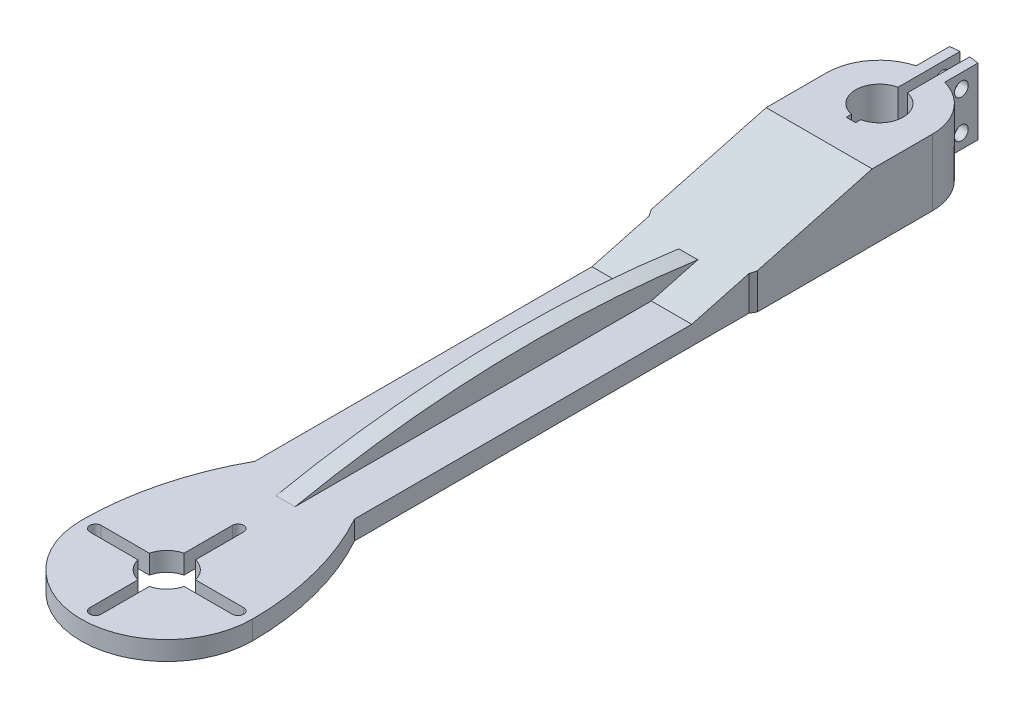
from build123d import *

# Parameters (mm, degrees)
SKETCH_1_R          = 5
EXTRUDE_1_DEPTH     = 4
SKETCH_2_R          = 5
EXTRUDE_2_DEPTH     = 10
CUT_EXTRUDE_2_DEPTH = 170.257200733
CHAMFER_1_SIZE      = 37.320508076
CHAMFER_1_SIZE_2    = 10
EXTRUDE_3_DEPTH     = 2
SKETCH_6_W          = 2
SKETCH_6_H          = 48
CUT_EXTRUDE_4_DEPTH = 170.54055562
SKETCH_7_R          = 1.45
CUT_EXTRUDE_5_DEPTH = 170.857764694


with BuildPart() as part:
    # 스케치1 → 보스-돌출1 (new body)
    with BuildSketch(Plane(origin=(0, 0, 0), x_dir=(1, 0, 0), z_dir=(0, 1, 0))):
        with BuildLine():
            ThreePointArc((18, 150), (0, 168), (-18, 150))
            Line((-18, 150), (-18, 0))
            ThreePointArc((-18, 0), (0, -18), (18, 0))
            Line((18, 0), (18, 150))
        make_face()
        with BuildLine():
            ThreePointArc((-15, -1.2), (-16.2, 0), (-15, 1.2))
            Line((-15, 1.2), (-4.85386444, 1.2))
            ThreePointArc((-4.85386444, 1.2), (-3.535533906, 3.535533906), (-1.2, 4.85386444))
            Line((-1.2, 4.85386444), (-1.2, 15))
            ThreePointArc((-1.2, 15), (0, 16.2), (1.2, 15))
            Line((1.2, 15), (1.2, 4.85386444))
            ThreePointArc((1.2, 4.85386444), (3.535533906, 3.535533906), (4.85386444, 1.2))
            Line((4.85386444, 1.2), (15, 1.2))
            ThreePointArc((15, 1.2), (16.2, 0), (15, -1.2))
            Line((15, -1.2), (4.85386444, -1.2))
            ThreePointArc((4.85386444, -1.2), (3.535533906, -3.535533906), (1.2, -4.85386444))
            Line((1.2, -4.85386444), (1.2, -15))
            ThreePointArc((1.2, -15), (0, -16.2), (-1.2, -15))
            Line((-1.2, -15), (-1.2, -4.85386444))
            ThreePointArc((-1.2, -4.85386444), (-3.535533906, -3.535533906), (-4.85386444, -1.2))
            Line((-4.85386444, -1.2), (-15, -1.2))
        make_face(mode=Mode.SUBTRACT)
        with Locations(Location((0, 150, 0), (0, 0, 270))):
            Circle(SKETCH_1_R, mode=Mode.SUBTRACT)
    extrude(amount=EXTRUDE_1_DEPTH)

    # 스케치2 → 보스-돌출2 (add)
    with BuildSketch(Plane(origin=(0, 4, 0), x_dir=(1, 0, 0), z_dir=(0, 1, 0))):
        with BuildLine():
            Line((-18, 100), (18, 100))
            Line((18, 100), (18, 150))
            ThreePointArc((18, 150), (0, 168), (-18, 150))
            Line((-18, 150), (-18, 100))
        make_face()
        with Locations(Location((0, 150, 0), (0, 0, 270))):
            Circle(SKETCH_2_R, mode=Mode.SUBTRACT)
    extrude(amount=EXTRUDE_2_DEPTH)

    # 스케치4 → 컷-돌출2 (cut, symmetric)
    with BuildSketch(Plane(origin=(0, 4, 0), x_dir=(1, 0, 0), z_dir=(0, 1, 0))):
        with BuildLine():
            Line((-10.5, 29.047375097), (-10.5, 112.009618943))
            Line((-10.5, 112.009618943), (-18, 125))
            Line((-18, 125), (-18, 0))
            ThreePointArc((-18, 0), (-16.094750193, 15), (-10.5, 29.047375097))
        make_face()
    cut_extrude_2 = extrude(amount=CUT_EXTRUDE_2_DEPTH, both=True, mode=Mode.SUBTRACT)

    # 대칭 복사1: 컷-돌출2 across plane
    add(cut_extrude_2.mirror(Plane(origin=(0, 0, 0), x_dir=(0, 0, 1), z_dir=(1, 0, 0))), mode=Mode.SUBTRACT)

    # 모따기1
    # the kernel refuses this chamfer: 37.320508076, 10 mm, written as the material it takes off along each edge
    with BuildSketch(Plane(origin=(-107.410968331, 14, -100), x_dir=(0, 0.009967146577156314, -0.9999503267608394), z_dir=(1, 0, 0))) as chamfer_1_piece_1_section:
        Polygon((CHAMFER_1_SIZE * 0.999950326753, -CHAMFER_1_SIZE * 0.00996714657707), (-CHAMFER_1_SIZE_2 * 0.00996714657716, -CHAMFER_1_SIZE_2 * 0.999950326761), (0, 0), align=None)
    chamfer_1_piece_1 = extrude(amount=214.821936662, mode=Mode.PRIVATE)
    chamfer_1_piece_1 = split(chamfer_1_piece_1, bisect_by=Plane(origin=(0, 4, -113.026597383), z_dir=(0, 1, 0)), keep=Keep.TOP, mode=Mode.PRIVATE)
    add(chamfer_1_piece_1, mode=Mode.SUBTRACT)

    # 스케치5 → 보스-돌출3 (add, symmetric)
    with BuildSketch(Plane(origin=(0, 0, 0), x_dir=(0, 0, -1), z_dir=(1, 0, 0))):
        with BuildLine():
            Line((25, 4), (125, 4))
            ThreePointArc((125, 4), (75, 9.051025722), (25, 4))
        make_face()
    extrude(amount=EXTRUDE_3_DEPTH, both=True)

    # 스케치6 → 컷-돌출4 (cut, through all)
    with BuildSketch(Plane(origin=(0, 14, 0), x_dir=(1, 0, 0), z_dir=(0, 1, 0))):
        with BuildLine():
            Line((-3, 167.748239349), (-3, 160.748239349))
            ThreePointArc((-3, 160.748239349), (-8.888245975, 156.74712773), (-11.159061301, 150))
            Line((-11.159061301, 150), (-11.159061301, 113.151146601))
            Line((-11.159061301, 113.151146601), (-22.159061301, 113.151146601))
            Line((-22.159061301, 113.151146601), (-22.159061301, 167.748239349))
            Line((-22.159061301, 167.748239349), (-3, 167.748239349))
        make_face()
        with BuildLine():
            Line((22.159061301, 167.748239349), (3, 167.748239349))
            Line((3, 167.748239349), (3, 160.748239349))
            ThreePointArc((3, 160.748239349), (8.888245975, 156.74712773), (11.159061301, 150))
            Line((11.159061301, 150), (11.159061301, 113.151146601))
            Line((11.159061301, 113.151146601), (22.159061301, 113.151146601))
            Line((22.159061301, 113.151146601), (22.159061301, 167.748239349))
        make_face()
        with Locations((0, 168)):
            Rectangle(SKETCH_6_W, SKETCH_6_H)
    extrude(amount=-CUT_EXTRUDE_4_DEPTH, mode=Mode.SUBTRACT)

    # 스케치7 → 컷-돌출5 (cut, through all)
    with BuildSketch(Plane(origin=(3, 0, 0), x_dir=(0, 0, -1), z_dir=(1, 0, 0))):
        with Locations((164.248239349, 11)):
            Circle(SKETCH_7_R)
        with Locations((164.248239349, 3)):
            Circle(SKETCH_7_R)
    extrude(amount=-CUT_EXTRUDE_5_DEPTH, mode=Mode.SUBTRACT)


solid = part.part
